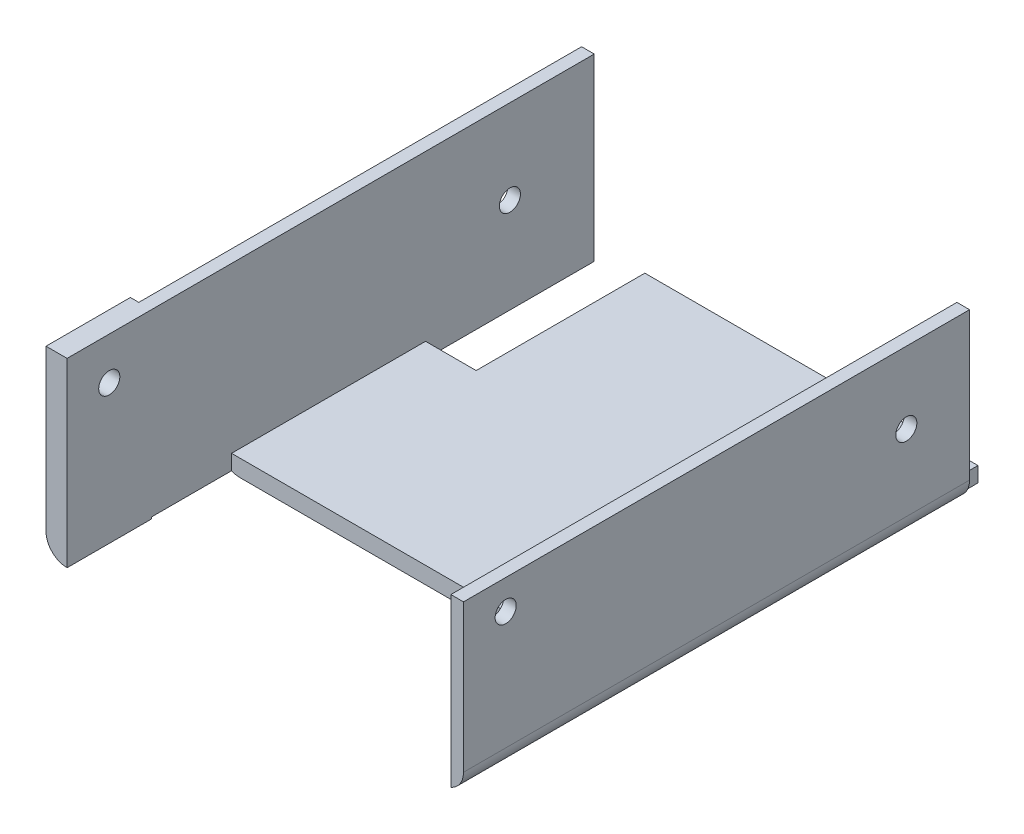
from build123d import *

# Parameters (mm, degrees)
SALIENTE_EXTRUIR1_DEPTH    = 125
CORTAR_EXTRUIR1_DEPTH      = 125
CORTAR_EXTRUIR1_DEPTH_BACK = 125
CROQUIS3_W                 = 4
CROQUIS3_H                 = 5
CROQUIS3_W_2               = 12
CROQUIS3_H_2               = 40
CROQUIS4_W                 = 91
CROQUIS4_H                 = 39
CORTAR_EXTRUIR2_DEPTH      = 125
CROQUIS5_W                 = 20
CROQUIS5_H                 = 43
SALIENTE_EXTRUIR2_DEPTH    = 2
CROQUIS6_R                 = 2.5
CORTAR_EXTRUIR3_DEPTH      = 124
CROQUIS7_R                 = 2.5
CORTAR_EXTRUIR4_DEPTH      = 124
REDONDEO1_R                = 5
REDONDEO2_R                = 5


# Some blends are built 0.0001 mm under size
with BuildPart() as part:
    # Croquis2 → Saliente-Extruir1 (new body)
    with BuildSketch(Plane.XY):
        Polygon((56.475617161, 13.42287234), (56.475617161, -26.57712766), (-40.524382839, -26.57712766), (-40.524382839, 16.42287234), (-37.524382839, 16.42287234), (-37.524382839, -22.57712766), (53.475617161, -22.57712766), (53.475617161, 13.42287234), align=None)
    extrude(amount=SALIENTE_EXTRUIR1_DEPTH)

    # Croquis3 → Cortar-Extruir1 (cut, two sides: drawn at the far end of the back side and taken through both)
    with BuildSketch(Plane(origin=(0, -22.57712766, 0), x_dir=(1, 0, 0), z_dir=(0, 1, 0)).offset(-CORTAR_EXTRUIR1_DEPTH_BACK)):
        with Locations((55.475617161, -2.5)):
            Rectangle(CROQUIS3_W, CROQUIS3_H)
        with Locations((-31.524382839, -20)):
            Rectangle(CROQUIS3_W_2, CROQUIS3_H_2)
    extrude(amount=CORTAR_EXTRUIR1_DEPTH + CORTAR_EXTRUIR1_DEPTH_BACK, mode=Mode.SUBTRACT)

    # Croquis4 → Cortar-Extruir2 (cut)
    with BuildSketch(Plane(origin=(0, -22.57712766, 0), x_dir=(1, 0, 0), z_dir=(0, 1, 0))):
        with Locations((7.975617161, -105.5)):
            Rectangle(CROQUIS4_W, CROQUIS4_H)
    extrude(amount=-CORTAR_EXTRUIR2_DEPTH, mode=Mode.SUBTRACT)

    # Croquis5 → Saliente-Extruir2 (add)
    with BuildSketch(Plane.ZY.offset(40.524382839)):
        with Locations((115, -5.07712766)):
            Rectangle(CROQUIS5_W, CROQUIS5_H)
    extrude(amount=SALIENTE_EXTRUIR2_DEPTH)

    # Croquis6 → Cortar-Extruir3 (cut)
    with BuildSketch(Plane.ZY.offset(40.524382839)):
        with Locations(Location((20, -3.57712766, 0), (0, 0, 270))):
            Circle(CROQUIS6_R)
    extrude(amount=-CORTAR_EXTRUIR3_DEPTH, mode=Mode.SUBTRACT)

    # Croquis7 → Cortar-Extruir4 (cut)
    with BuildSketch(Plane.ZY.offset(42.524382839)):
        with Locations((115, 6.42287234)):
            Circle(CROQUIS7_R)
    extrude(amount=-CORTAR_EXTRUIR4_DEPTH, mode=Mode.SUBTRACT)

    # Redondeo1
    # the kernel refuses this fillet: 5 mm, written as the material it takes off along each edge
    with BuildSketch(Plane(origin=(56.475617161, -26.57712766, -7.5), x_dir=(0, 1, 0), z_dir=(0, 0, 1))) as redondeo1_piece_1:
        with BuildLine():
            CenterArc((REDONDEO1_R, REDONDEO1_R), REDONDEO1_R, 180, 90)
            Line((0, REDONDEO1_R), (0, 0))
            Line((0, 0), (REDONDEO1_R, 0))
        make_face()
    extrude(amount=145, mode=Mode.SUBTRACT)
    with BuildSketch(Plane(origin=(-40.524382839, -26.57712766, -12.5), x_dir=(1, 0, 0), z_dir=(0, 0, 1))) as redondeo1_piece_2:
        with BuildLine():
            CenterArc((REDONDEO1_R, REDONDEO1_R), REDONDEO1_R, 180, 90)
            Line((0, REDONDEO1_R), (0, 0))
            Line((0, 0), (REDONDEO1_R, 0))
        make_face()
    extrude(amount=117.5, mode=Mode.SUBTRACT)

    # Redondeo2
    redondeo2_edges = [part.edges().sort_by_distance(p)[0] for p in [
        (-42.524382839, -26.57712766, 115),
    ]]
    fillet(redondeo2_edges, radius=REDONDEO2_R - 0.0001)  # a hair under: the kernel refuses the full size


solid = part.part
